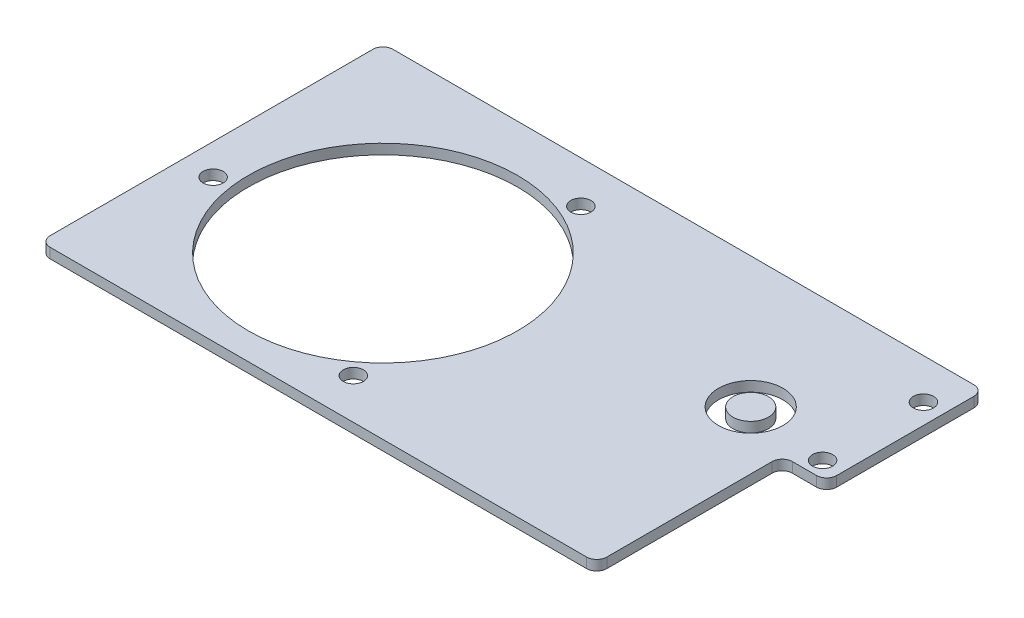
from build123d import *

# Parameters (mm, degrees)
SKETCH1_R           = 84.7725
SKETCH1_R_2         = 6.35
BOSS_EXTRUDE1_DEPTH = 6.35
SKETCH4_R           = 20.32
SKETCH4_R_2         = 11.176
CUT_EXTRUDE1_DEPTH  = 9.652


with BuildPart() as part:
    # Sketch1 → Boss-Extrude1 (new body)
    with BuildSketch(Plane(origin=(0, 0, 0), x_dir=(1, 0, 0), z_dir=(0, 1, 0))):
        with BuildLine():
            Line((257.81, 114.3), (-107.95, 114.3))
            ThreePointArc((-107.95, 114.3), (-112.440128061, 112.440128061), (-114.3, 107.95))
            Line((-114.3, 107.95), (-114.3, -95.25))
            ThreePointArc((-114.3, -95.25), (-112.440128061, -99.740128061), (-107.95, -101.6))
            Line((-107.95, -101.6), (229.87, -101.6))
            ThreePointArc((229.87, -101.6), (234.360128061, -99.740128061), (236.22, -95.25))
            Line((236.22, -95.25), (236.22, 8.89))
            ThreePointArc((236.22, 8.89), (238.079871939, 13.380128061), (242.57, 15.24))
            Line((242.57, 15.24), (257.81, 15.24))
            ThreePointArc((257.81, 15.24), (262.300128061, 17.099871939), (264.16, 21.59))
            Line((264.16, 21.59), (264.16, 107.95))
            ThreePointArc((264.16, 107.95), (262.300128061, 112.440128061), (257.81, 114.3))
        make_face()
        Circle(SKETCH1_R, mode=Mode.SUBTRACT)
        with Locations((-94.868167092, -12.066247058)):
            Circle(SKETCH1_R_2, mode=Mode.SUBTRACT)
        with Locations((36.791640664, 87.857485038)):
            Circle(SKETCH1_R_2, mode=Mode.SUBTRACT)
        with Locations((57.498227222, -76.125119184)):
            Circle(SKETCH1_R_2, mode=Mode.SUBTRACT)
        with Locations((251.46, 88.9)):
            Circle(SKETCH1_R_2, mode=Mode.SUBTRACT)
        with Locations((251.46, 25.4)):
            Circle(SKETCH1_R_2, mode=Mode.SUBTRACT)
    extrude(amount=BOSS_EXTRUDE1_DEPTH)

    # Sketch4 → Cut-Extrude1 (cut)
    with BuildSketch(Plane(origin=(0, 6.35, 0), x_dir=(1, 0, 0), z_dir=(0, 1, 0))):
        with Locations((199.663269189, 31.949583289)):
            Circle(SKETCH4_R)
        with Locations((199.663269189, 31.949583289)):
            Circle(SKETCH4_R_2, mode=Mode.SUBTRACT)
    extrude(amount=-CUT_EXTRUDE1_DEPTH, mode=Mode.SUBTRACT)


with BuildPart() as cut_extrude1_piece_1:
    # of the separate pieces the step leaves, piece 1, a body of its own (cut_extrude1_pieces)
    add(part.part.solids().sort_by_distance((257.81, 0, -114.3))[0])


with BuildPart() as cut_extrude1_piece_2:
    # of the separate pieces the step leaves, piece 2, a body of its own (cut_extrude1_pieces)
    add(part.part.solids().sort_by_distance((210.839269189, 0, -31.949583289))[0])


solid = Compound([cut_extrude1_piece_1.part, cut_extrude1_piece_2.part])
